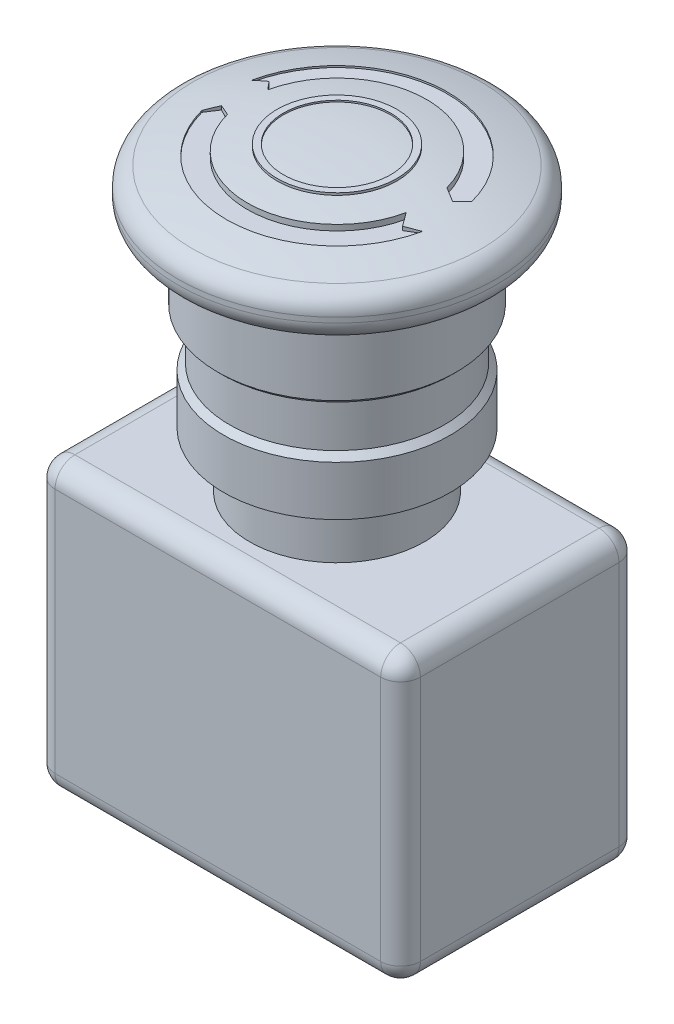
from build123d import *

# Parameters (mm, degrees)
FILLET_2_R          = 2.5
CUT_EXTRUDE_2_DEPTH = 4.5
SKETCH_6_R          = 7.544495516
SKETCH_6_R_2        = 6.742597779
EXTRUDE_2_DEPTH     = 7.9
SKETCH_7_R          = 15
EXTRUDE_3_DEPTH     = 10
CHAMFER_1_SIZE      = 0.5
SKETCH_8_R          = 13.5
EXTRUDE_4_DEPTH     = 7
SKETCH_9_R          = 14.25
EXTRUDE_5_DEPTH     = 6
CHAMFER_2_SIZE      = 1
SKETCH_10_R         = 11
EXTRUDE_6_DEPTH     = 7
SKETCH_11_W         = 46
SKETCH_11_H         = 30
EXTRUDE_7_DEPTH     = 36
FILLET_3_R          = 2.5


with BuildPart() as part:
    # Эскиз2 → Повернуть1 (revolve)
    with BuildSketch(Plane.XY, mode=Mode.PRIVATE) as revolve_1_sk:
        with BuildLine():
            Line((0, 2.930948498), (20, 2.930948498))
            Line((20, 2.930948498), (20, 7.930948498))
            add(Edge.make_bspline(
                [(20, 7.930948498), (10.236656465, 11.004873072), (0, 10.930948498)],
                knots=[0, 0, 0, 1, 1, 1], degree=2))
            Line((0, 10.930948498), (0, 2.930948498))
        make_face()
    revolve(revolve_1_sk.sketch.rotate(Axis((0, 45.754032666, 0), (0, -1, 0)), 90), axis=Axis((0, 45.754032666, 0), (0, -1, 0)))

    # Скругление2
    fillet_2_edges = [part.edges().sort_by_distance(p)[0] for p in [
        (0, 2.930948498, -20),
        (0, 7.930948498, -20),
    ]]
    fillet(fillet_2_edges, radius=FILLET_2_R)

    # Эскиз5 → Вырез-Вытянуть2 (cut)
    with BuildSketch(Plane(origin=(0, 13.812870775, 0), x_dir=(1, 0, 0), z_dir=(0, 1, 0))):
        with BuildLine():
            Line((-13.616818713, 2.867646528), (-12.134990634, 3.590023912))
            Line((-12.134990634, 3.590023912), (-11.048077198, 2.326680033))
            ThreePointArc((-11.048077198, 2.326680033), (-0.317231994, 11.285956477), (10.899937011, 2.943607126))
            Line((10.899937011, 2.943607126), (12.486323695, 2.058637888))
            Line((12.486323695, 2.058637888), (13.476651449, 3.467133424))
            ThreePointArc((13.476651449, 3.467133424), (-0.307827631, 13.91209512), (-13.616818713, 2.867646528))
        make_face()
        with BuildLine():
            Line((11.046374652, -2.334749837), (12.066615041, -3.813537836))
            Line((12.066615041, -3.813537836), (13.616818713, -2.867646528))
            ThreePointArc((13.616818713, -2.867646528), (0.349599989, -13.911108091), (-13.455587055, -3.548003025))
            Line((-13.455587055, -3.548003025), (-12.486323695, -2.058637888))
            Line((-12.486323695, -2.058637888), (-10.917619437, -2.877331328))
            ThreePointArc((-10.917619437, -2.877331328), (0.278824577, -11.286970657), (11.046374652, -2.334749837))
        make_face()
    extrude(amount=-CUT_EXTRUDE_2_DEPTH, mode=Mode.SUBTRACT)

    # Эскиз6 → Бобышка-Вытянуть2 (add)
    with BuildSketch(Plane.XZ.offset(-2.930948498)):
        with Locations(Location((0, 0, 0), (0, 0, 270))):
            Circle(SKETCH_6_R)
        with Locations(Location((0, 0, 0), (0, 0, 270))):
            Circle(SKETCH_6_R_2, mode=Mode.SUBTRACT)
    extrude(amount=-EXTRUDE_2_DEPTH)

    # Эскиз7 → Бобышка-Вытянуть3 (add)
    with BuildSketch(Plane.XZ.offset(-2.930948498)):
        with Locations(Location((0, 0, 0), (0, 0, 90))):
            Circle(SKETCH_7_R)
    extrude(amount=EXTRUDE_3_DEPTH)

    # Фаска1
    chamfer_1_edges = [part.edges().sort_by_distance(p)[0] for p in [
        (0, -7.069051502, -15),
    ]]
    chamfer(chamfer_1_edges, length=CHAMFER_1_SIZE)

    # Эскиз8 → Бобышка-Вытянуть4 (add)
    with BuildSketch(Plane.XZ.offset(7.069051502)):
        with Locations(Location((0, 0, 0), (0, 0, 270))):
            Circle(SKETCH_8_R)
    extrude(amount=EXTRUDE_4_DEPTH)

    # Эскиз9 → Бобышка-Вытянуть5 (add)
    with BuildSketch(Plane.XZ.offset(14.069051502)):
        with Locations(Location((0, 0, 0), (0, 0, 270))):
            Circle(SKETCH_9_R)
    extrude(amount=EXTRUDE_5_DEPTH)

    # Фаска2
    # the kernel refuses this chamfer: 1 mm, written as the material it adds along each edge
    with BuildSketch(Plane(origin=(0, -14.069051502, 0), x_dir=(0, 0, -1), z_dir=(-1, 0, 0))) as chamfer_2_piece_1_section:
        Polygon((13.5 + CHAMFER_2_SIZE, 0), (13.5, -CHAMFER_2_SIZE), (13.5, 0), align=None)
    chamfer_2_piece_1 = revolve(axis=Axis((0, -14.069051502, 0), (0, -1, 0)), mode=Mode.PRIVATE)
    chamfer_2_piece_1 = chamfer_2_piece_1 & Plane(origin=(0, -13.454886429, 0), x_dir=(0, 0, -1), z_dir=(0, 1, 0)) * Cylinder(14.25, 58, mode=Mode.PRIVATE)
    add(chamfer_2_piece_1)

    # Эскиз10 → Бобышка-Вытянуть6 (add)
    with BuildSketch(Plane.XZ.offset(20.069051502)):
        with Locations(Location((0, 0, 0), (0, 0, 270))):
            Circle(SKETCH_10_R)
    extrude(amount=EXTRUDE_6_DEPTH)

    # Эскиз11 → Бобышка-Вытянуть7 (add)
    with BuildSketch(Plane.XZ.offset(27.069051502)):
        Rectangle(SKETCH_11_W, SKETCH_11_H)
    extrude(amount=EXTRUDE_7_DEPTH)

    # Скругление3
    fillet_3_edges = [part.edges().sort_by_distance(p)[0] for p in [
        (-23, -27.069051502, 0),
        (-23, -45.069051502, 15),
        (0, -27.069051502, -15),
        (-23, -45.069051502, -15),
        (23, -27.069051502, 0),
        (23, -45.069051502, -15),
        (0, -27.069051502, 15),
        (23, -45.069051502, 15),
        (-23, -63.069051502, 0),
        (0, -63.069051502, -15),
        (23, -63.069051502, 0),
        (0, -63.069051502, 15),
    ]]
    fillet(fillet_3_edges, radius=FILLET_3_R)


solid = part.part
